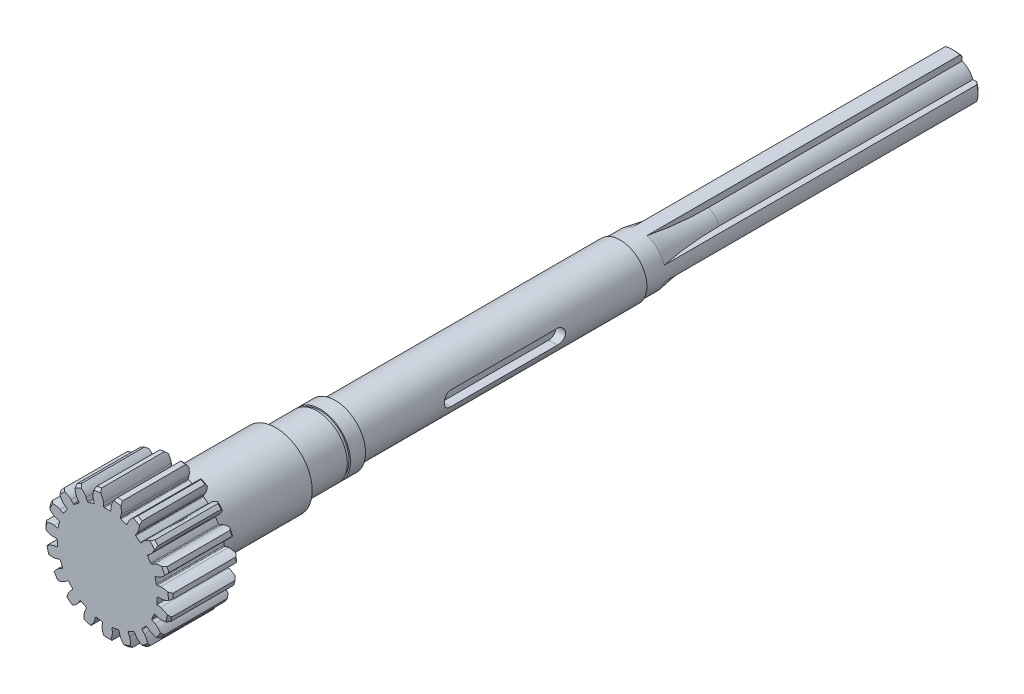
from build123d import *

# Parameters (mm, degrees)
SKETCH_1142_R                    = 26.25
EXTRUDE_1168_DEPTH               = 14
CHAMFER_1207_SIZE                = 1
CUT_EXTRUDE_1603_DEPTH           = 14
FILLET_2_R                       = 0.3
PATTERN_CIRCULAR_2_COUNT         = 19
FILLET_2_OF_PATTERN_CIRCULAR_2_R = 0.3
CUT_EXTRUDE_START                = 2
SKETCH_2_OUTSIDE_W               = 125.898
SKETCH_2_OUTSIDE_H               = 125.737
SKETCH_2_OUTSIDE_R               = 14.3
CUT_EXTRUDE_1_DEPTH              = 1.3
CUT_EXTRUDE_START_2              = 17
SKETCH_3_OUTSIDE_W               = 125.898
SKETCH_3_OUTSIDE_H               = 125.737
SKETCH_3_OUTSIDE_R               = 11.95
CUT_EXTRUDE_2_DEPTH              = 1.3
CUT_EXTRUDE_START_3              = 7
CUT_EXTRUDE_3_DEPTH              = 331.545481949
CHAMFER_1_SIZE                   = 1
CUT_EXTRUDE_4_DEPTH              = 130
FILLET_3_R                       = 130


with BuildPart() as part:
    # Sketch 1142 → Extrude 1168 (new, symmetric)
    with BuildSketch(Plane.XY):
        Circle(SKETCH_1142_R)
    extrude(amount=EXTRUDE_1168_DEPTH, both=True)

    # Chamfer 1207
    chamfer_1207_edges = [part.edges().sort_by_distance(p)[0] for p in [
        (-26.25, 0, -14),
        (-26.25, 0, 14),
    ]]
    chamfer(chamfer_1207_edges, length=CHAMFER_1207_SIZE)

    # Sketch 1288 → Cut-Extrude 1603 (cut, symmetric)
    with BuildSketch(Plane.XY):
        with BuildLine():
            ThreePointArc((-1.446896868, 20.574185633), (0, 20.625), (1.446896868, 20.574185633))
            Line((1.446896868, 20.574185633), (1.565644114, 22.262715027))
            add(Edge.make_bspline(
                [(1.565644114, 22.262715027), (1.568622967, 22.305072903), (1.577185508, 22.389488696), (1.604671075, 22.557121978), (1.659349261, 22.797420193), (1.736799354, 23.067147486), (1.863861218, 23.437251434), (2.061433099, 23.920798455), (2.353327125, 24.514646639), (2.725341978, 25.145747072), (3.050543901, 25.624678642), (3.265296093, 25.917333058), (3.3541342, 26.034828284)],
                knots=[0, 0, 0, 0, 0, 0.001401017, 0.002802034, 0.005604068, 0.008132613, 0.010661158, 0.015718248, 0.022839082, 0.029959916, 0.034823518, 0.034823518, 0.034823518, 0.034823518, 0.034823518], degree=4))
            ThreePointArc((3.3541342, 26.034828284), (0, 26.25), (-3.3541342, 26.034828284))
            add(Edge.make_bspline(
                [(-1.565644114, 22.262715027), (-1.568622967, 22.305072903), (-1.577185508, 22.389488696), (-1.604671075, 22.557121978), (-1.659349261, 22.797420193), (-1.736799354, 23.067147486), (-1.863861218, 23.437251434), (-2.061433099, 23.920798455), (-2.353327125, 24.514646639), (-2.725341978, 25.145747072), (-3.050543901, 25.624678642), (-3.265296093, 25.917333058), (-3.3541342, 26.034828284)],
                knots=[0, 0, 0, 0, 0, 0.001401017, 0.002802034, 0.005604068, 0.008132613, 0.010661158, 0.015718248, 0.022839082, 0.029959916, 0.034823518, 0.034823518, 0.034823518, 0.034823518, 0.034823518], degree=4))
            Line((-1.565644114, 22.262715027), (-1.446896868, 20.574185633))
        make_face()
    cut_extrude_1603 = extrude(amount=CUT_EXTRUDE_1603_DEPTH, both=True, mode=Mode.SUBTRACT)

    # 圆角2
    fillet_2_edges = [part.edges().sort_by_distance(p)[0] for p in [
        (1.446896868, 20.574185633, 0),
        (-1.446896868, 20.574185633, 0),
    ]]
    fillet(fillet_2_edges, radius=FILLET_2_R)

    # 圆周阵列2: Cut-Extrude 1603 ×19 about axis
    pattern_circular_2_axis = Axis((0, 0, 14), (0, 0, -1))
    for i in range(1, PATTERN_CIRCULAR_2_COUNT):
        add(cut_extrude_1603.rotate(pattern_circular_2_axis, i * 360 / PATTERN_CIRCULAR_2_COUNT), mode=Mode.SUBTRACT)

    # 圆角2 of 圆周阵列2
    fillet_2_of_pattern_circular_2_edges = [part.edges().sort_by_distance(p)[0] for p in [
        (8.048927159, 18.989612861, 0),
        (5.31192715, 19.92922615, 0),
        (13.7787313, 15.347220881, 0),
        (11.495121438, 17.124625781, 0),
        (18.015396106, 10.041719382, 0),
        (16.432640953, 12.464306492, 0),
        (20.299813206, 3.648041774, 0),
        (19.589428842, 6.453286191, 0),
        (20.384430562, -3.140957764, 0),
        (20.623398154, -0.257047802, 0),
        (18.260078569, -9.589585792, 0),
        (19.422502272, -6.939526677, 0),
        (14.156963728, -14.999033402, 0),
        (16.116876897, -12.870000159, 0),
        (8.5197222, -18.783103009, 0),
        (11.064737831, -17.405809424, 0),
        (1.959236574, -20.531731954, 0),
        (4.813562735, -20.05542916, 0),
        (-4.813562735, -20.05542916, 0),
        (-1.959236574, -20.531731954, 0),
        (-11.064737831, -17.405809424, 0),
        (-8.5197222, -18.783103009, 0),
        (-16.116876897, -12.870000159, 0),
        (-14.156963728, -14.999033402, 0),
        (-19.422502272, -6.939526677, 0),
        (-18.260078569, -9.589585792, 0),
        (-20.623398154, -0.257047802, 0),
        (-20.384430562, -3.140957764, 0),
        (-19.589428842, 6.453286191, 0),
        (-20.299813206, 3.648041774, 0),
        (-16.432640953, 12.464306492, 0),
        (-18.015396106, 10.041719382, 0),
        (-11.495121438, 17.124625781, 0),
        (-13.7787313, 15.347220881, 0),
        (-5.31192715, 19.92922615, 0),
        (-8.048927159, 18.989612861, 0),
    ]]
    fillet(fillet_2_of_pattern_circular_2_edges, radius=FILLET_2_OF_PATTERN_CIRCULAR_2_R)

    # 草图1 → 旋转1 (revolve)
    with BuildSketch(Plane(origin=(0, 0, 0), x_dir=(0, 0, -1), z_dir=(1, 0, 0)), mode=Mode.PRIVATE) as revolve_1_sk:
        Polygon((14, 0), (14, 15), (55.5, 15), (55.5, 12.5), (80, 12.5), (80, 11), (197.5, 11), (197.5, 10.5), (335.5, 10.5), (335.5, 0), align=None)
    revolve(revolve_1_sk.sketch.rotate(Axis((0, 0, 0), (0, 0, -1)), 180), axis=Axis((0, 0, 0), (0, 0, -1)))

    # 草图2 outside → 切除-拉伸1 (cut)
    with BuildSketch(Plane(origin=(0, 0, -14), x_dir=(-1, 0, 0), z_dir=(0, 0, -1)).offset(CUT_EXTRUDE_START)):
        with Locations((0, -0.1075)):
            Rectangle(SKETCH_2_OUTSIDE_W, SKETCH_2_OUTSIDE_H)
        Circle(SKETCH_2_OUTSIDE_R, mode=Mode.SUBTRACT)
    extrude(amount=CUT_EXTRUDE_1_DEPTH, mode=Mode.SUBTRACT)

    # 草图3 outside → 切除-拉伸2 (cut)
    with BuildSketch(Plane(origin=(0, 0, -55.5), x_dir=(-1, 0, 0), z_dir=(0, 0, -1)).offset(CUT_EXTRUDE_START_2)):
        with Locations((0, -0.1075)):
            Rectangle(SKETCH_3_OUTSIDE_W, SKETCH_3_OUTSIDE_H)
        with Locations(Location((0, 0, 0), (0, 0, 90))):
            Circle(SKETCH_3_OUTSIDE_R, mode=Mode.SUBTRACT)
    extrude(amount=CUT_EXTRUDE_2_DEPTH, mode=Mode.SUBTRACT)

    # 草图4 → 切除-拉伸3 (cut, through all)
    with BuildSketch(Plane(origin=(0, 0, 0), x_dir=(0, 0, -1), z_dir=(1, 0, 0)).offset(CUT_EXTRUDE_START_3)):
        with BuildLine():
            Line((117, 3), (161, 3))
            ThreePointArc((161, 3), (164, 0), (161, -3))
            Line((161, -3), (117, -3))
            ThreePointArc((117, -3), (114, 0), (117, 3))
        make_face()
    extrude(amount=CUT_EXTRUDE_3_DEPTH, mode=Mode.SUBTRACT)

    # 倒角1
    chamfer_1_edges = [part.edges().sort_by_distance(p)[0] for p in [
        (0, 10.5, -335.5),
    ]]
    chamfer(chamfer_1_edges, length=CHAMFER_1_SIZE)

    # 草图5 → 切除-拉伸4 (cut)
    with BuildSketch(Plane(origin=(0, 0, -335.5), x_dir=(-1, 0, 0), z_dir=(0, 0, -1))):
        with BuildLine():
            Line((-3, 7.416198487), (-3, 10.062305899))
            ThreePointArc((-3, 10.062305899), (-7.424621202, 7.424621202), (-10.062305899, 3))
            Line((-10.062305899, 3), (-7.416198487, 3))
            ThreePointArc((-7.416198487, 3), (-5.656854249, 5.656854249), (-3, 7.416198487))
        make_face()
        with BuildLine():
            Line((3, 7.416198487), (3, 10.062305899))
            ThreePointArc((3, 10.062305899), (7.424621202, 7.424621202), (10.062305899, 3))
            Line((10.062305899, 3), (7.416198487, 3))
            ThreePointArc((7.416198487, 3), (5.656854249, 5.656854249), (3, 7.416198487))
        make_face()
        with BuildLine():
            Line((7.416198487, -3), (10.062305899, -3))
            ThreePointArc((10.062305899, -3), (7.424621202, -7.424621202), (3, -10.062305899))
            Line((3, -10.062305899), (3, -7.416198487))
            ThreePointArc((3, -7.416198487), (5.656854249, -5.656854249), (7.416198487, -3))
        make_face()
        with BuildLine():
            Line((-3, -7.416198487), (-3, -10.062305899))
            ThreePointArc((-3, -10.062305899), (-7.424621202, -7.424621202), (-10.062305899, -3))
            Line((-10.062305899, -3), (-7.416198487, -3))
            ThreePointArc((-7.416198487, -3), (-5.656854249, -5.656854249), (-3, -7.416198487))
        make_face()
    extrude(amount=-CUT_EXTRUDE_4_DEPTH, mode=Mode.SUBTRACT)

    # 圆角3
    # the kernel refuses this fillet: 130 mm, written as the material it adds along each edge
    with BuildSketch(Plane(origin=(0, 0, -205.5), x_dir=(-0.7048818539423675, 0.7093247295722679, 0), z_dir=(-0.7093247295722679, -0.7048818539423675, 0))) as fillet_3_piece_1:
        with BuildLine():
            CenterArc((138, 25.372228913), FILLET_3_R, 180, 11.254712618)
            Line((10.5, 0), (8, 0))
            Line((8, 0), (8, 25.372228913))
        make_face()
    revolve(axis=Axis((0, 0, -205.5), (0, 0, -1)), revolution_arc=359.64)
    with BuildSketch(Plane(origin=(0, 0, -205.5), x_dir=(0.7093247295722701, 0.7048818539423654, 0), z_dir=(-0.7048818539423654, 0.7093247295722701, 0))) as fillet_3_piece_2:
        with BuildLine():
            CenterArc((138, 25.372228913), FILLET_3_R, 180, 11.254712618)
            Line((10.5, 0), (8, 0))
            Line((8, 0), (8, 25.372228913))
        make_face()
    revolve(axis=Axis((0, 0, -205.5), (0, 0, -1)), revolution_arc=359.64)
    with BuildSketch(Plane(origin=(0, 0, -205.5), x_dir=(0.7048818539423626, -0.7093247295722728, 0), z_dir=(0.7093247295722728, 0.7048818539423626, 0))) as fillet_3_piece_3:
        with BuildLine():
            CenterArc((138, 25.372228913), FILLET_3_R, 180, 11.254712618)
            Line((10.5, 0), (8, 0))
            Line((8, 0), (8, 25.372228913))
        make_face()
    revolve(axis=Axis((0, 0, -205.5), (0, 0, -1)), revolution_arc=359.64)
    with BuildSketch(Plane(origin=(0, 0, -205.5), x_dir=(-0.7048818539423574, -0.709324729572278, 0), z_dir=(-0.709324729572278, 0.7048818539423574, 0))) as fillet_3_piece_4:
        with BuildLine():
            CenterArc((138, -25.372228913), FILLET_3_R, 168.745287382, 11.254712618)
            Line((10.5, 0), (8, 0))
            Line((8, 0), (8, -25.372228913))
        make_face()
    revolve(axis=Axis((0, 0, -205.5), (0, 0, 1)), revolution_arc=359.64)


solid = part.part
